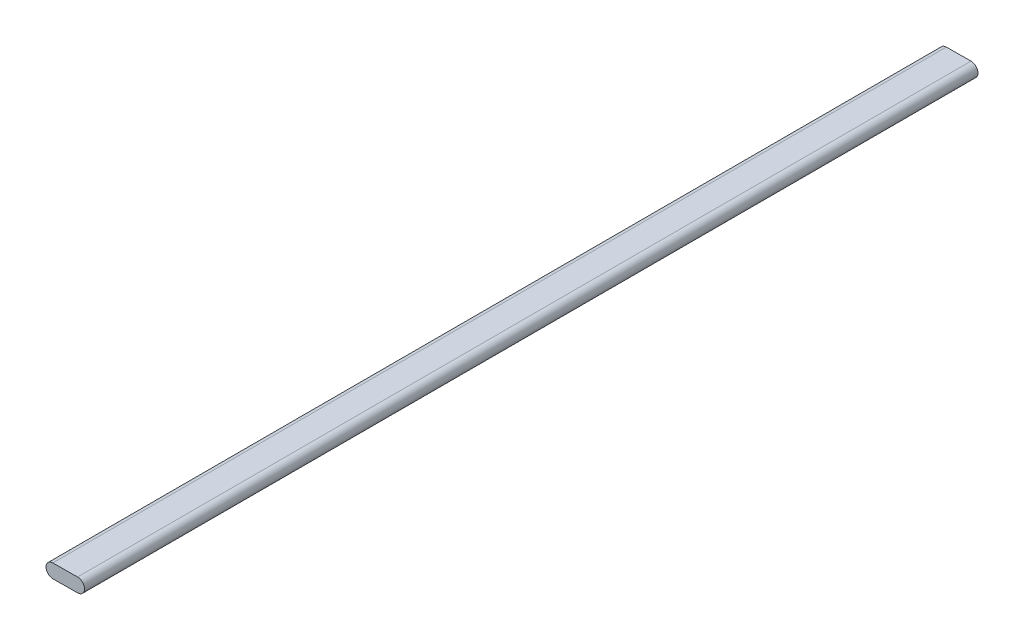
from build123d import *

# Parameters (mm, degrees)
SALIENTE_EXTRUIR1_DEPTH = 130


with BuildPart() as part:
    # Croquis1 → Saliente-Extruir1 (new body)
    with BuildSketch(Plane.XY):
        with BuildLine():
            Line((-1.808444423, 3.729487345), (1.79142455, 3.760201733))
            ThreePointArc((1.79142455, 3.760201733), (2.799919928, 2.768769904), (1.808488099, 1.760274525))
            Line((1.808488099, 1.760274525), (-1.791380875, 1.729560138))
            ThreePointArc((-1.791380875, 1.729560138), (-2.799876253, 2.720991967), (-1.808444423, 3.729487345))
        make_face()
    extrude(amount=SALIENTE_EXTRUIR1_DEPTH)


solid = part.part
